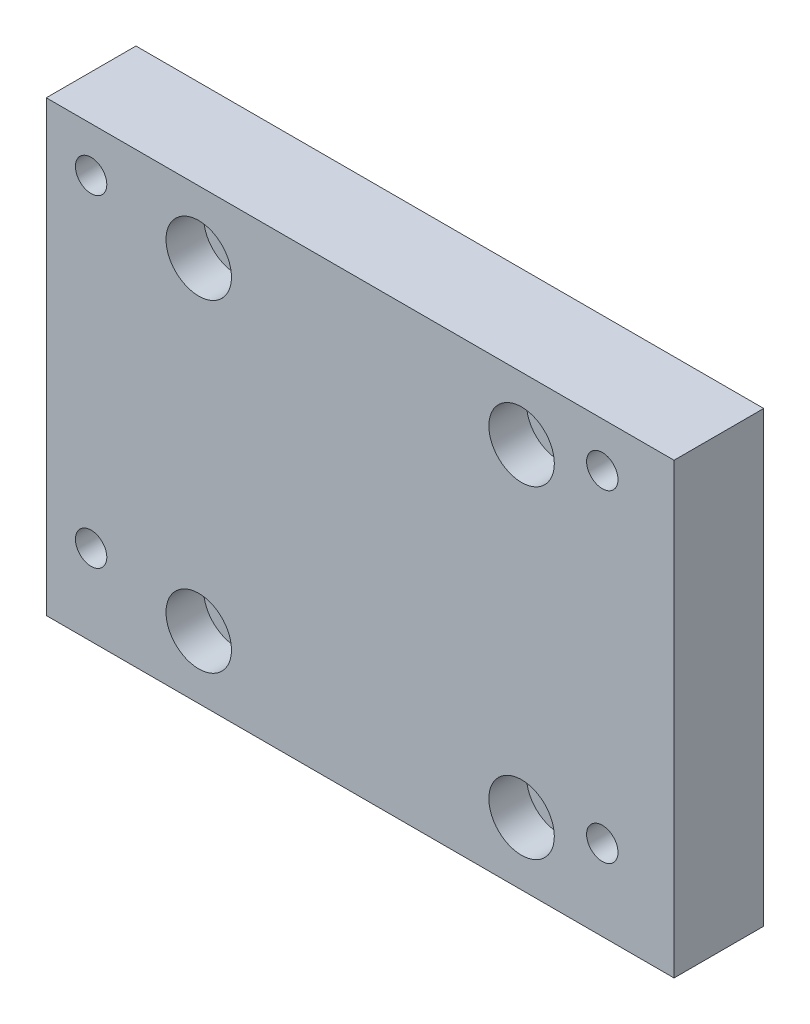
from build123d import *

# Parameters (mm, degrees)
SKETCH_2_W                = 70
SKETCH_2_H                = 50
SKETCH_2_R                = 2.25
SKETCH_2_R_2              = 1.75
EXTRUDE_1_DEPTH           = 10
HOLE_WIZARD_1_D           = 4.5
HOLE_WIZARD_1_CBORE_D     = 7.3
HOLE_WIZARD_1_CBORE_DEPTH = 4.2
CUT_EXTRUDE_1_DEPTH       = 2.5


with BuildPart() as part:
    # 草圖2 → 填料-伸長1 (new body)
    with BuildSketch(Plane.XY):
        Rectangle(SKETCH_2_W, SKETCH_2_H)
        with Locations((-18, 18)):
            Circle(SKETCH_2_R, mode=Mode.SUBTRACT)
        with Locations((-30, 20)):
            Circle(SKETCH_2_R_2, mode=Mode.SUBTRACT)
        with Locations((18, 18)):
            Circle(SKETCH_2_R, mode=Mode.SUBTRACT)
        with Locations((18, -18)):
            Circle(SKETCH_2_R, mode=Mode.SUBTRACT)
        with Locations((-18, -18)):
            Circle(SKETCH_2_R, mode=Mode.SUBTRACT)
        with Locations((27, 20)):
            Circle(SKETCH_2_R_2, mode=Mode.SUBTRACT)
        with Locations((27, -16)):
            Circle(SKETCH_2_R_2, mode=Mode.SUBTRACT)
        with Locations((-30, -16)):
            Circle(SKETCH_2_R_2, mode=Mode.SUBTRACT)
    extrude(amount=EXTRUDE_1_DEPTH)

    # 鑽孔1 (through all)
    with Locations(Plane(origin=(-18, 18, 10), x_dir=(1, 0, 0), z_dir=(0, 0, 1))):
        with Locations((0, 0), (36, 0), (36, -36), (0, -36)):
            CounterBoreHole(HOLE_WIZARD_1_D / 2, HOLE_WIZARD_1_CBORE_D / 2, HOLE_WIZARD_1_CBORE_DEPTH)

    # 草圖4 → 除料-伸長1 (cut)
    with BuildSketch(Plane(origin=(0, 0, 0), x_dir=(-1, 0, 0), z_dir=(0, 0, -1))):
        Polygon((-23.709103466, 20), (-25.354551733, 22.85), (-28.645448267, 22.85), (-30.290896534, 20), (-28.645448267, 17.15), (-25.354551733, 17.15), align=None)
        Polygon((26.709103466, 20), (28.354551733, 17.15), (31.645448267, 17.15), (33.290896534, 20), (31.645448267, 22.85), (28.354551733, 22.85), align=None)
        Polygon((26.709103466, -16), (28.354551733, -18.85), (31.645448267, -18.85), (33.290896534, -16), (31.645448267, -13.15), (28.354551733, -13.15), align=None)
        Polygon((-23.709103466, -16), (-25.354551733, -13.15), (-28.645448267, -13.15), (-30.290896534, -16), (-28.645448267, -18.85), (-25.354551733, -18.85), align=None)
    extrude(amount=-CUT_EXTRUDE_1_DEPTH, mode=Mode.SUBTRACT)


solid = part.part
